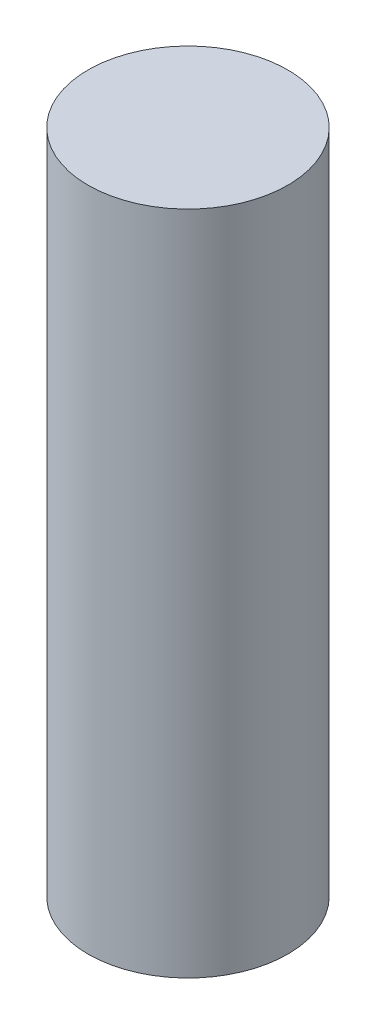
from build123d import *

# Parameters (mm, degrees)
SKETCH1_R           = 1.5
BOSS_EXTRUDE1_DEPTH = 10


with BuildPart() as part:
    # Sketch1 → Boss-Extrude1 (new body)
    with BuildSketch(Plane(origin=(0, 0, 0), x_dir=(1, 0, 0), z_dir=(0, 1, 0))):
        Circle(SKETCH1_R)
    extrude(amount=-BOSS_EXTRUDE1_DEPTH)


solid = part.part
